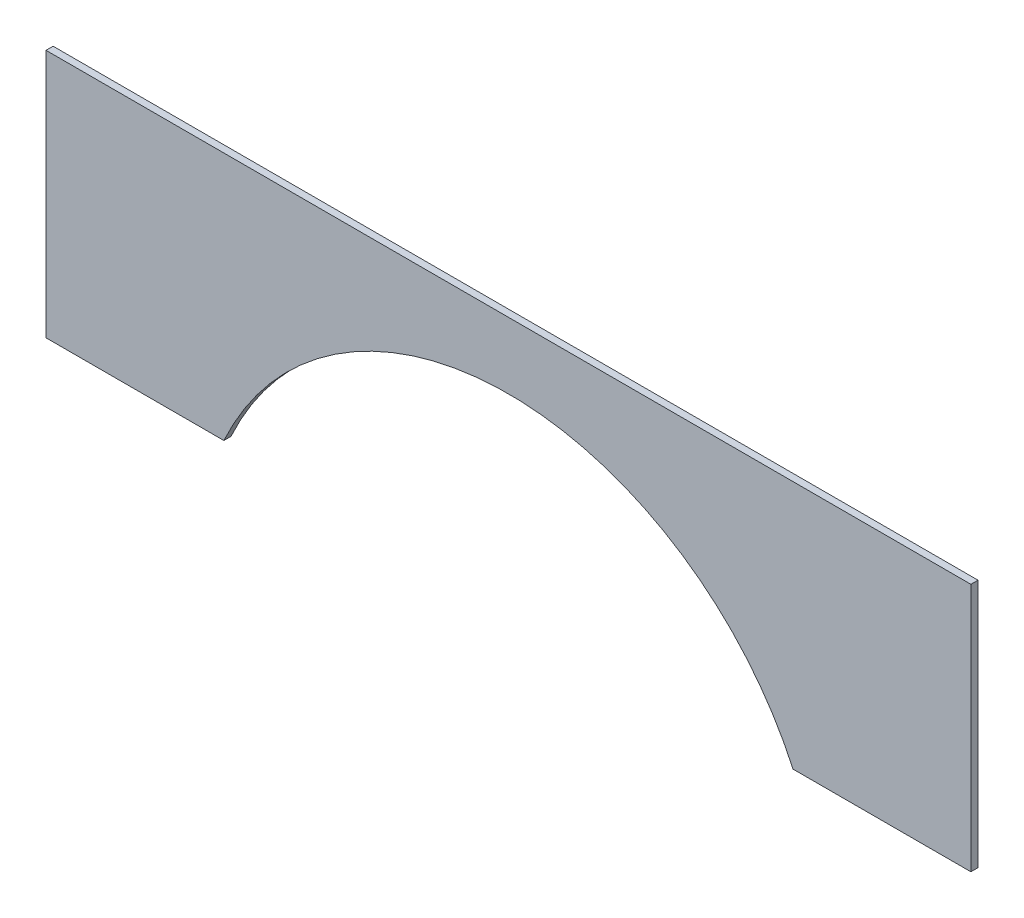
from build123d import *

# Parameters (mm, degrees)
BOSS_EXTRUDE1_DEPTH = 2.54


with BuildPart() as part:
    # Sketch1 → Boss-Extrude1 (new body)
    with BuildSketch(Plane.XY):
        with BuildLine():
            Line((0, 0), (63.5, 0))
            ThreePointArc((63.5, 0), (165.1, 65.241929906), (266.7, 0))
            Line((266.7, 0), (330.2, 0))
            Line((330.2, 0), (330.2, 88.9))
            Line((330.2, 88.9), (0, 88.9))
            Line((0, 88.9), (0, 0))
        make_face()
    extrude(amount=BOSS_EXTRUDE1_DEPTH)


solid = part.part
